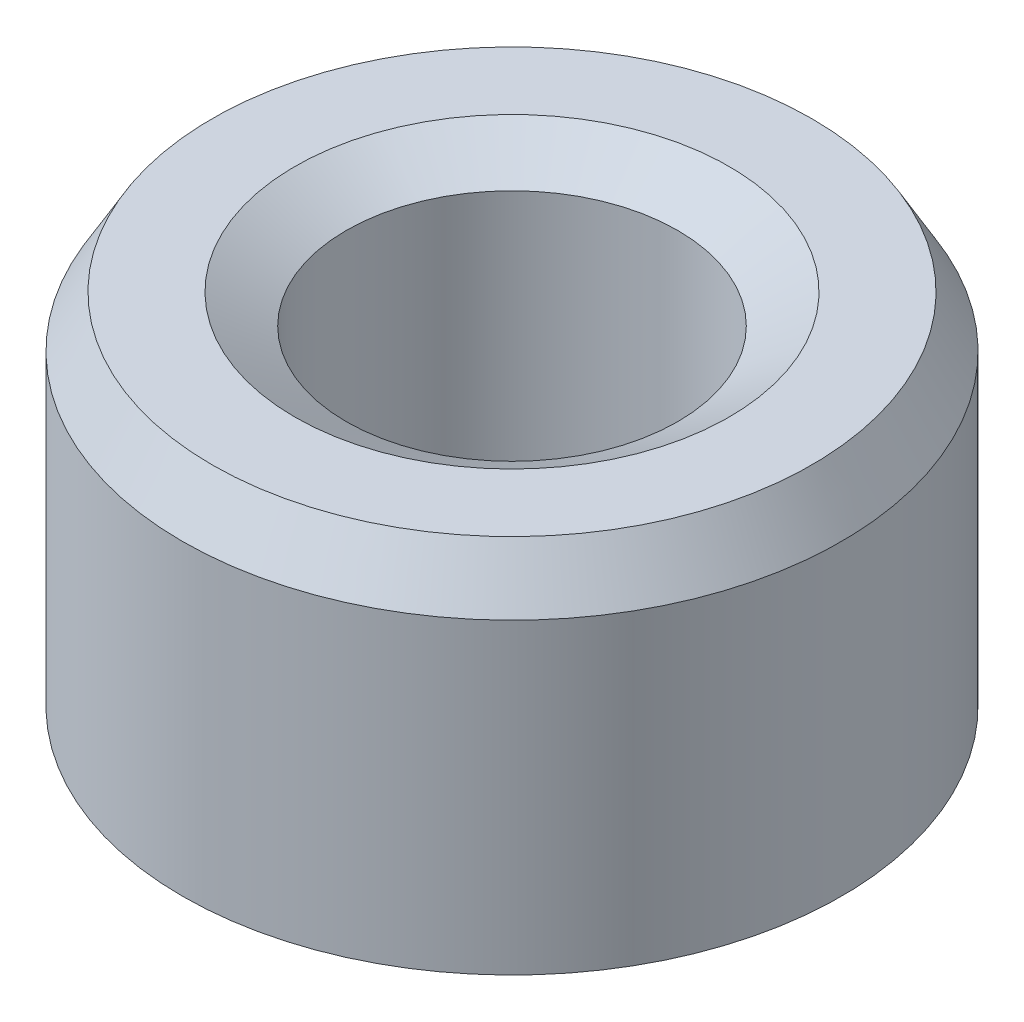
from build123d import *
from OCP.BRepFilletAPI import BRepFilletAPI_MakeChamfer

# Parameters (mm, degrees)
SKETCH1_R           = 7.5
BOSS_EXTRUDE1_DEPTH = 8.83941326
SKETCH2_R           = 3.771001242
CUT_EXTRUDE1_DEPTH  = 14.807071622
CHAMFER1_SIZE       = 1.170245787
CHAMFER1_SIZE2      = 0.67564172


with BuildPart() as part:
    # Sketch1 → Boss-Extrude1 (new body)
    with BuildSketch(Plane(origin=(0, 0, 0), x_dir=(1, 0, 0), z_dir=(0, 1, 0))):
        Circle(SKETCH1_R)
    extrude(amount=BOSS_EXTRUDE1_DEPTH)

    # Sketch2 → Cut-Extrude1 (cut, through all)
    with BuildSketch(Plane(origin=(0, 0, 0), x_dir=(1, 0, 0), z_dir=(0, 1, 0))):
        Circle(SKETCH2_R)
    extrude(amount=CUT_EXTRUDE1_DEPTH, mode=Mode.SUBTRACT)

    # Chamfer1: one chamfer whose edges measure the first distance from different faces: ONE call of the kernel's chamfer builder (chamfer() names one face for all edges)
    chamfer1_edges_1 = [part.edges().sort_by_distance(p)[0] for p in [
        (-3.771001242, 8.83941326, 0),
    ]]
    chamfer1_side_1 = [part.faces().sort_by_distance(p)[0] for p in [
        (-7.287867966, 8.83941326, 0),
    ]]
    chamfer1_edges_2 = [part.edges().sort_by_distance(p)[0] for p in [
        (-3.771001242, 0, 0),
    ]]
    chamfer1_side_2 = [part.faces().sort_by_distance(p)[0] for p in [
        (-3.771001242, 4.41970663, 0),
    ]]
    chamfer1_edges_3 = [part.edges().sort_by_distance(p)[0] for p in [
        (-7.5, 0, 0),
    ]]
    chamfer1_side_3 = [part.faces().sort_by_distance(p)[0] for p in [
        (-7.287867966, 0, 0),
    ]]
    chamfer1_edges_4 = [part.edges().sort_by_distance(p)[0] for p in [
        (-7.5, 8.83941326, 0),
    ]]
    chamfer1_side_4 = [part.faces().sort_by_distance(p)[0] for p in [
        (-7.5, 4.41970663, 0),
    ]]
    chamfer1 = BRepFilletAPI_MakeChamfer(part.part.solid().wrapped)
    for e in chamfer1_edges_1:
        chamfer1.Add(CHAMFER1_SIZE, CHAMFER1_SIZE2, e.wrapped, chamfer1_side_1[0].wrapped)  # the first distance lies on this face
    for e in chamfer1_edges_2:
        chamfer1.Add(CHAMFER1_SIZE, CHAMFER1_SIZE2, e.wrapped, chamfer1_side_2[0].wrapped)  # the first distance lies on this face
    for e in chamfer1_edges_3:
        chamfer1.Add(CHAMFER1_SIZE, CHAMFER1_SIZE2, e.wrapped, chamfer1_side_3[0].wrapped)  # the first distance lies on this face
    for e in chamfer1_edges_4:
        chamfer1.Add(CHAMFER1_SIZE, CHAMFER1_SIZE2, e.wrapped, chamfer1_side_4[0].wrapped)  # the first distance lies on this face
    add(Compound.cast(chamfer1.Shape()), mode=Mode.REPLACE)


solid = part.part
